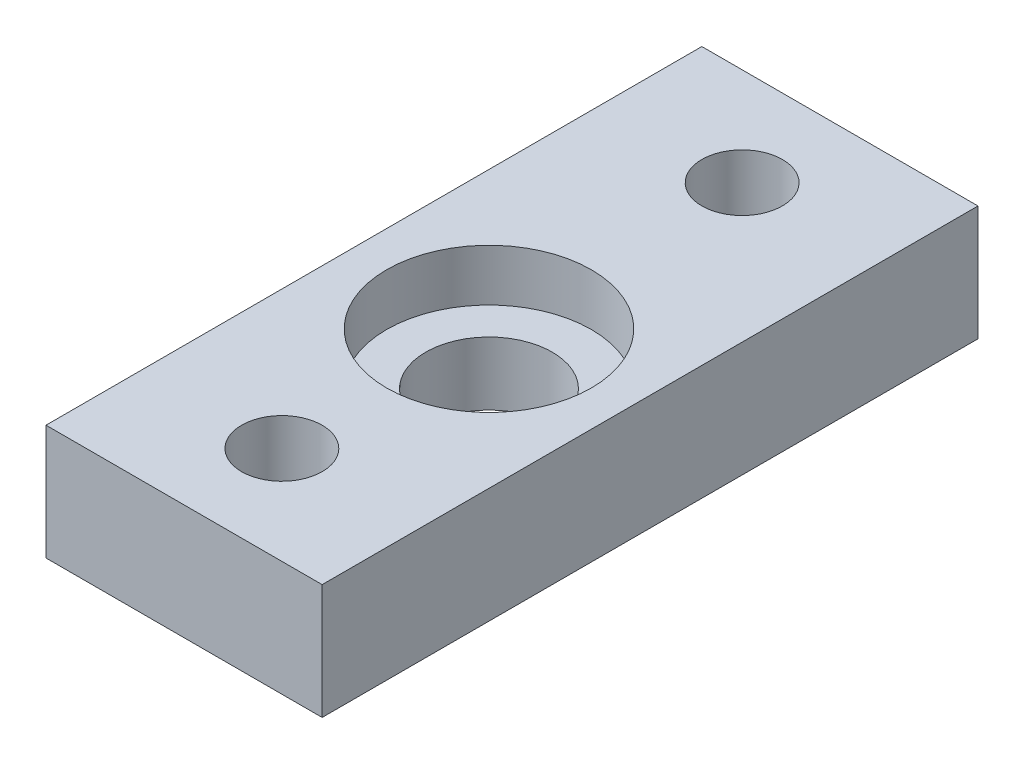
from build123d import *

# Parameters (mm, degrees)
SKETCH1_W           = 12
SKETCH1_H           = 28.5
SKETCH1_R           = 1.75
SKETCH1_R_2         = 2.75
BOSS_EXTRUDE1_DEPTH = 5
SKETCH2_R           = 4.45
CUT_EXTRUDE1_DEPTH  = 2.25


with BuildPart() as part:
    # Sketch1 → Boss-Extrude1 (new body)
    with BuildSketch(Plane(origin=(0, 0, 0), x_dir=(1, 0, 0), z_dir=(0, 1, 0))):
        with Locations((6, 14.25)):
            Rectangle(SKETCH1_W, SKETCH1_H)
        with Locations((6, 24.25)):
            Circle(SKETCH1_R, mode=Mode.SUBTRACT)
        with Locations((6, 4.25)):
            Circle(SKETCH1_R, mode=Mode.SUBTRACT)
        with Locations((6, 13.25)):
            Circle(SKETCH1_R_2, mode=Mode.SUBTRACT)
    extrude(amount=BOSS_EXTRUDE1_DEPTH)

    # Sketch2 → Cut-Extrude1 (cut)
    with BuildSketch(Plane(origin=(0, 5, 0), x_dir=(1, 0, 0), z_dir=(0, 1, 0))):
        with Locations((6, 13.25)):
            Circle(SKETCH2_R)
    extrude(amount=-CUT_EXTRUDE1_DEPTH, mode=Mode.SUBTRACT)


solid = part.part
